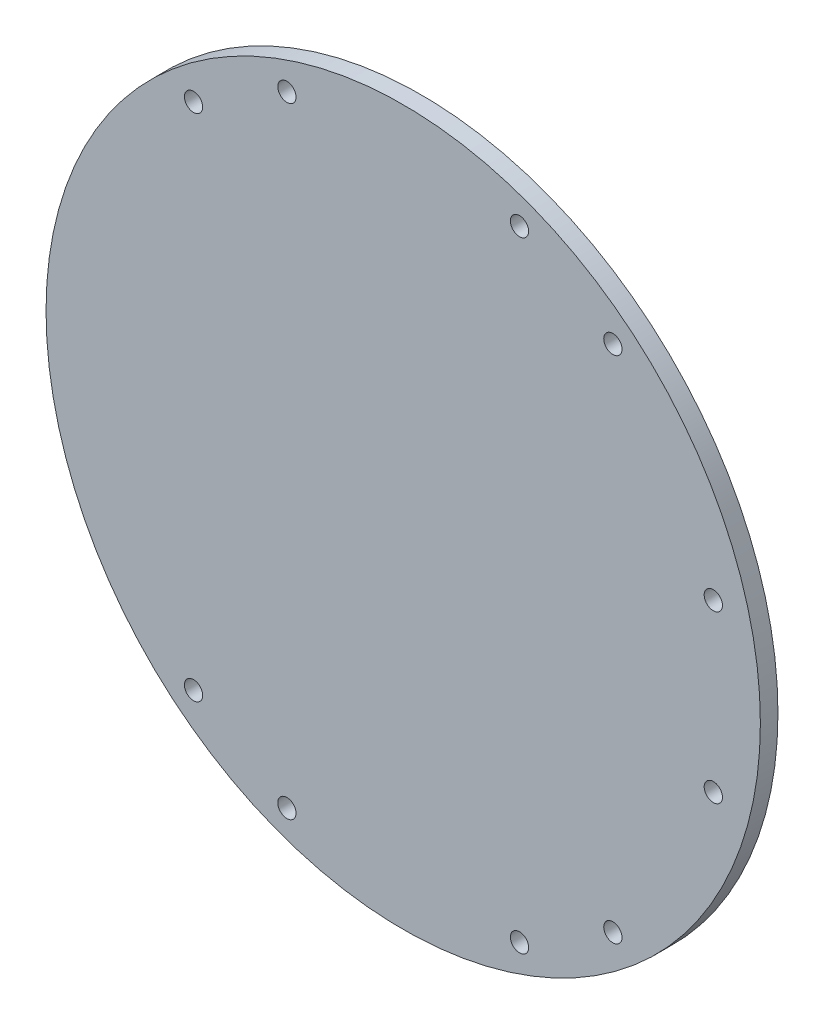
from build123d import *

# Parameters (mm, degrees)
SKETCH1_R           = 64.5
SKETCH1_R_2         = 1.65
BOSS_EXTRUDE1_DEPTH = 3.175


with BuildPart() as part:
    # Sketch1 → Boss-Extrude1 (new body)
    with BuildSketch(Plane(origin=(0, 0, 0), x_dir=(-1, 0, 0), z_dir=(0, 0, 1))):
        with Locations((15.168596538, -5.633574242)):
            Circle(SKETCH1_R)
        with Locations((-5.831403462, 50.366425758)):
            Circle(SKETCH1_R_2, mode=Mode.SUBTRACT)
        with Locations((-22.69188657, 40.366425758)):
            Circle(SKETCH1_R_2, mode=Mode.SUBTRACT)
        with Locations((36.168596538, 50.366425758)):
            Circle(SKETCH1_R_2, mode=Mode.SUBTRACT)
        with Locations((53.029079646, 40.366425758)):
            Circle(SKETCH1_R_2, mode=Mode.SUBTRACT)
        with Locations((53.029079646, -51.633574242)):
            Circle(SKETCH1_R_2, mode=Mode.SUBTRACT)
        with Locations((36.168596538, -61.633574242)):
            Circle(SKETCH1_R_2, mode=Mode.SUBTRACT)
        with Locations((-5.831403462, -61.633574242)):
            Circle(SKETCH1_R_2, mode=Mode.SUBTRACT)
        with Locations((-22.69188657, -51.633574242)):
            Circle(SKETCH1_R_2, mode=Mode.SUBTRACT)
        with Locations((-40.831403462, 9.366425758)):
            Circle(SKETCH1_R_2, mode=Mode.SUBTRACT)
        with Locations((-40.831403462, -20.633574242)):
            Circle(SKETCH1_R_2, mode=Mode.SUBTRACT)
    extrude(amount=BOSS_EXTRUDE1_DEPTH)


solid = part.part
